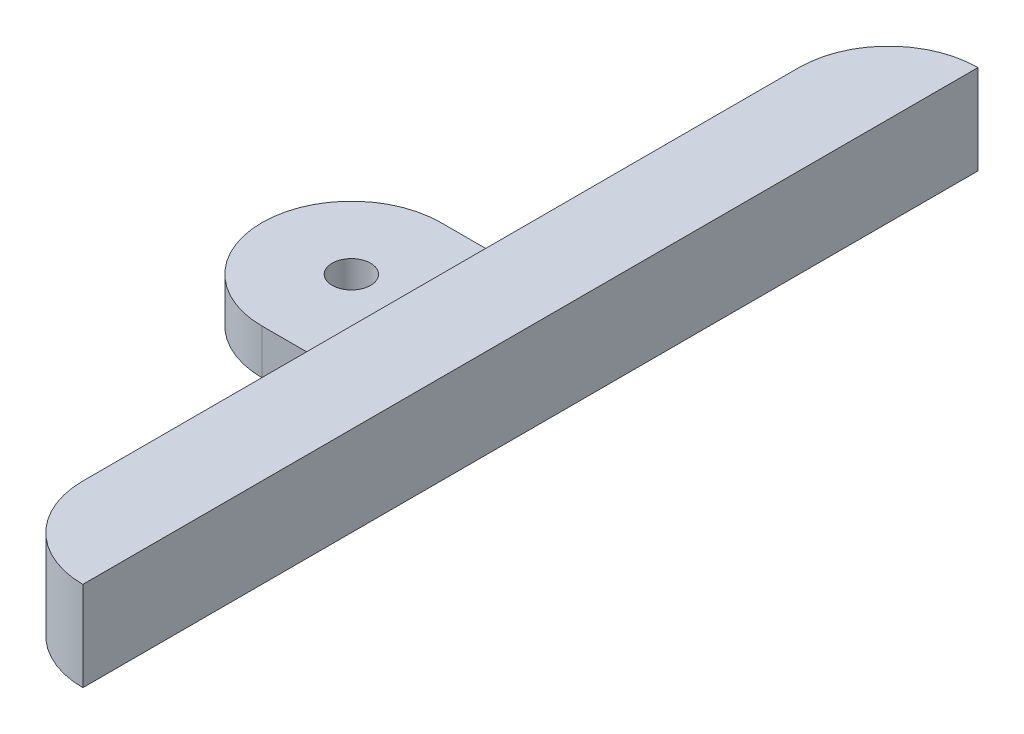
from build123d import *

# Parameters (mm, degrees)
SKETCH1_W           = 10
SKETCH1_H           = 100
BOSS_EXTRUDE1_DEPTH = 5
SKETCH2_W           = 10
SKETCH2_H           = 100
BOSS_EXTRUDE2_DEPTH = 5
SKETCH3_W           = 20
SKETCH3_H           = 5
BOSS_EXTRUDE3_DEPTH = 20
FILLET1_R           = 10
CUT_EXTRUDE1_REACH  = 60.523
SKETCH4_R           = 2.15
FILLET2_R           = 10


with BuildPart() as part:
    # Sketch1 → Boss-Extrude1 (new body)
    with BuildSketch(Plane(origin=(0, 0, 0), x_dir=(1, 0, 0), z_dir=(0, 1, 0))):
        with Locations((-5, 0)):
            Rectangle(SKETCH1_W, SKETCH1_H)
    extrude(amount=BOSS_EXTRUDE1_DEPTH)

    # Sketch2 → Boss-Extrude2 (add)
    with BuildSketch(Plane(origin=(0, 5, 0), x_dir=(1, 0, 0), z_dir=(0, 1, 0))):
        with Locations((-5, 0)):
            Rectangle(SKETCH2_W, SKETCH2_H)
    extrude(amount=BOSS_EXTRUDE2_DEPTH)

    # Sketch3 → Boss-Extrude3 (add)
    with BuildSketch(Plane.ZY.offset(10)):
        with Locations((0, 2.5)):
            Rectangle(SKETCH3_W, SKETCH3_H)
    extrude(amount=BOSS_EXTRUDE3_DEPTH)

    # Fillet1
    fillet1_edges = [part.edges().sort_by_distance(p)[0] for p in [
        (-30, 2.5, 10),
        (-30, 2.5, -10),
    ]]
    fillet(fillet1_edges, radius=FILLET1_R - 0.0001)  # a hair under: the kernel refuses the full size

    # Sketch4 → Cut-Extrude1 (cut, up to next)
    with BuildSketch(Plane(origin=(0, 5, 0), x_dir=(1, 0, 0), z_dir=(0, 1, 0)), mode=Mode.PRIVATE) as cut_extrude1_sk1:
        with Locations(Location((-20, 0, 0), (0, 0, 270))):
            Circle(SKETCH4_R)
    cut_extrude1_tool1 = extrude(cut_extrude1_sk1.sketch, amount=-CUT_EXTRUDE1_REACH, mode=Mode.PRIVATE) & part.part
    add(cut_extrude1_tool1.solids().sort_by_distance((-20, 5, 0))[0], mode=Mode.SUBTRACT)

    # Fillet2
    fillet2_edges = [part.edges().sort_by_distance(p)[0] for p in [
        (-10, 5, -50),
        (-10, 5, 50),
    ]]
    fillet(fillet2_edges, radius=FILLET2_R - 0.0001)  # a hair under: the kernel refuses the full size


solid = part.part
